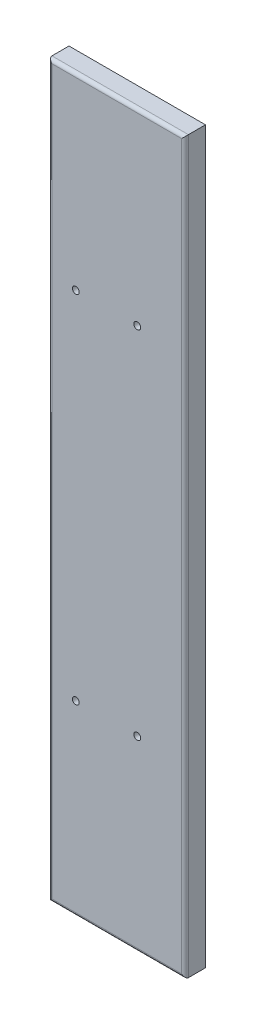
from build123d import *

# Parameters (mm, degrees)
SKETCH1_W                   = 127
SKETCH1_H                   = 679.45
BOSS_EXTRUDE1_DEPTH         = 19.05
F_1_4_0_25_DIAMETER_HOLE1_D = 6.35
FILLET1_R                   = 3.175


with BuildPart() as part:
    # Sketch1 → Boss-Extrude1 (new body)
    with BuildSketch(Plane.XY):
        with Locations((9.525, -165.1)):
            Rectangle(SKETCH1_W, SKETCH1_H)
    extrude(amount=BOSS_EXTRUDE1_DEPTH)

    # 1/4 (0.25) Diameter Hole1 (through all)
    with Locations(Plane.XY.offset(19.05)):
        with Locations((-28.575, 0), (28.575, 0), (-28.575, -330.911799988), (28.575, -330.911799988)):
            Hole(F_1_4_0_25_DIAMETER_HOLE1_D / 2)

    # Fillet1
    fillet1_edges = [part.edges().sort_by_distance(p)[0] for p in [
        (9.525, 174.625, 19.05),
        (9.525, -504.825, 19.05),
        (73.025, -165.1, 19.05),
        (-53.975, -165.1, 19.05),
    ]]
    fillet(fillet1_edges, radius=FILLET1_R)


solid = part.part
